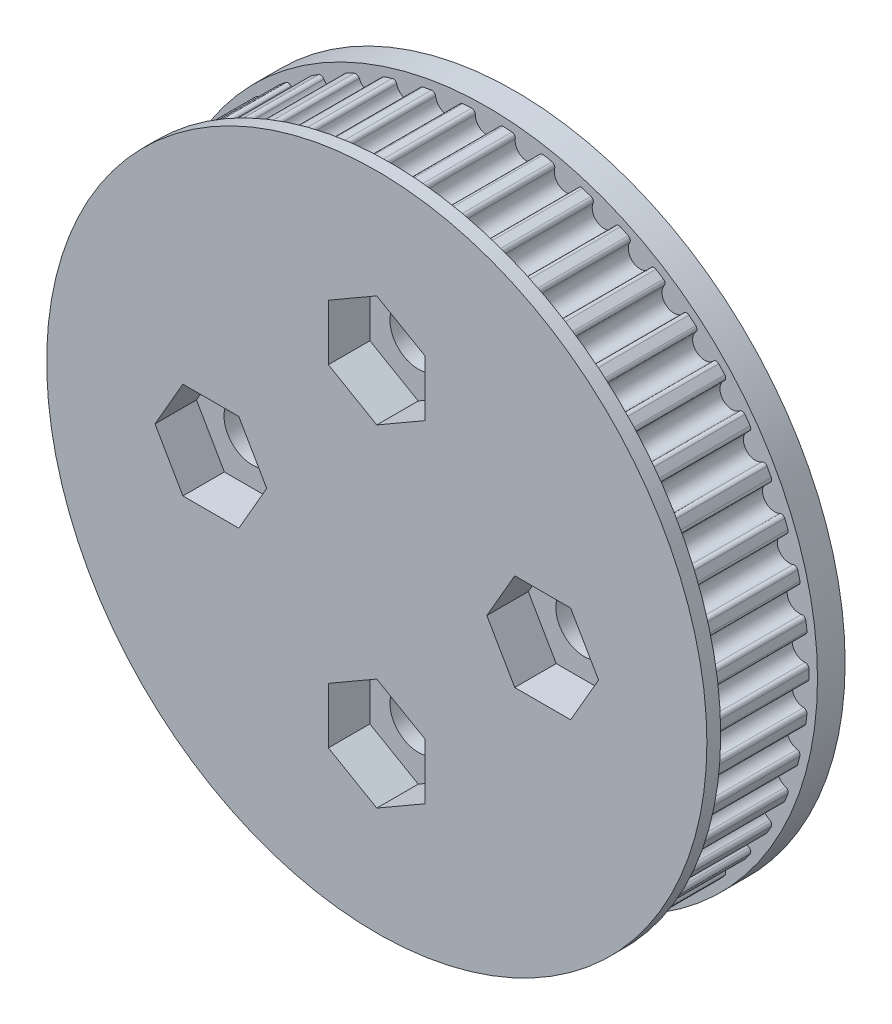
from build123d import *

# Parameters (mm, degrees)
BOSS_EXTRUDE2_DEPTH      = 3.5
FILLET2_R                = 0.26
CIRPATTERN6_COUNT        = 50
FILLET2_OF_CIRPATTERN6_R = 0.26
SKETCH2_R                = 23.875
BOSS_EXTRUDE3_DEPTH      = 1
SKETCH2_6_R              = 2.05
CUT_EXTRUDE4_DEPTH       = 2
SKETCH2_7_R              = 2.05
CUT_EXTRUDE5_DEPTH       = 7
BOSS_EXTRUDE4_START      = -7
SKETCH2_8_R              = 23.875
SKETCH2_8_R_2            = 2.05
BOSS_EXTRUDE4_DEPTH      = 2
SKETCH5_R                = 16.25
CUT_EXTRUDE6_DEPTH       = 3


with BuildPart() as part:
    # Sketch1 → Boss-Extrude2 (new, symmetric)
    with BuildSketch(Plane(origin=(0, 0, 0), x_dir=(0, 1, 0), z_dir=(0, 0, 1))):
        with BuildLine():
            Line((1.386932157, 22.044655365), (0, 0))
            Line((0, 0), (2.91503061, 23.074843283))
            ThreePointArc((2.91503061, 23.074843283), (2.597607065, 23.11272882), (2.279692792, 23.146248006))
            ThreePointArc((2.279692792, 23.146248006), (2.117464236, 22.36516737), (1.386932157, 22.044655365))
        make_face()
        with BuildLine():
            Line((0, 23.258241464), (0, 0))
            Line((0, 0), (1.386932157, 22.044655365))
            ThreePointArc((1.386932157, 22.044655365), (0.702331348, 22.454199985), (0.639277374, 23.249454196))
            ThreePointArc((0.639277374, 23.249454196), (0.319668882, 23.256044543), (0, 23.258241464))
        make_face()
    boss_extrude2 = extrude(amount=BOSS_EXTRUDE2_DEPTH, both=True)

    # Fillet2
    fillet2_edges = [part.edges().sort_by_distance(p)[0] for p in [
        (-23.146248006, 2.279692792, 0),
        (-23.249454196, 0.639277374, 0),
    ]]
    fillet(fillet2_edges, radius=FILLET2_R)

    # CirPattern6: Boss-Extrude2 ×50 about axis
    cirpattern6_axis = Axis((0, 0, 0), (0, 0, 1))
    for i in range(1, CIRPATTERN6_COUNT):
        add(boss_extrude2.rotate(cirpattern6_axis, i * 360 / CIRPATTERN6_COUNT))

    # Fillet2 of CirPattern6
    fillet2_of_cirpattern6_edges = [part.edges().sort_by_distance(p)[0] for p in [
        (-23.249454196, -0.639277374, 0),
        (-23.146248006, -2.279692792, 0),
        (-22.986002605, -3.548165754, 0),
        (-22.678011658, -5.162710841, 0),
        (-22.360048022, -6.40109744, 0),
        (-21.852129519, -7.964309856, 0),
        (-21.381462124, -9.153079997, 0),
        (-20.681626243, -10.640306947, 0),
        (-20.065677796, -11.760713013, 0),
        (-19.184961367, -13.148500041, 0),
        (-18.433445742, -14.18287256, 0),
        (-17.38573819, -15.449333435, 0),
        (-16.510507238, -16.381359734, 0),
        (-15.312331536, -17.506521611, 0),
        (-14.327188171, -18.32150308, 0),
        (-12.997440266, -19.287621484, 0),
        (-11.917920788, -19.972705377, 0),
        (-10.477571599, -20.764544044, 0),
        (-9.320700675, -21.308926179, 0),
        (-7.792465369, -21.913997341, 0),
        (-6.576487544, -22.309092486, 0),
        (-4.984467305, -22.717853809, 0),
        (-3.728559277, -22.957431078, 0),
        (-2.097861214, -23.163436151, 0),
        (-0.821829402, -23.243717268, 0),
        (0.821829402, -23.243717268, 0),
        (2.097861214, -23.163436151, 0),
        (3.728559277, -22.957431078, 0),
        (4.984467305, -22.717853809, 0),
        (6.576487544, -22.309092486, 0),
        (7.792465369, -21.913997341, 0),
        (9.320700675, -21.308926179, 0),
        (10.477571599, -20.764544044, 0),
        (11.917920788, -19.972705377, 0),
        (12.997440266, -19.287621484, 0),
        (14.327188171, -18.32150308, 0),
        (15.312331536, -17.506521611, 0),
        (16.510507238, -16.381359734, 0),
        (17.38573819, -15.449333435, 0),
        (18.433445742, -14.18287256, 0),
        (19.184961367, -13.148500041, 0),
        (20.065677796, -11.760713013, 0),
        (20.681626243, -10.640306947, 0),
        (21.381462124, -9.153079997, 0),
        (21.852129519, -7.964309856, 0),
        (22.360048022, -6.40109744, 0),
        (22.678011658, -5.162710841, 0),
        (22.986002605, -3.548165754, 0),
        (23.146248006, -2.279692792, 0),
        (23.249454196, -0.639277374, 0),
        (23.249454196, 0.639277374, 0),
        (23.146248006, 2.279692792, 0),
        (22.986002605, 3.548165754, 0),
        (22.678011658, 5.162710841, 0),
        (22.360048022, 6.40109744, 0),
        (21.852129519, 7.964309856, 0),
        (21.381462124, 9.153079997, 0),
        (20.681626243, 10.640306947, 0),
        (20.065677796, 11.760713013, 0),
        (19.184961367, 13.148500041, 0),
        (18.433445742, 14.18287256, 0),
        (17.38573819, 15.449333435, 0),
        (16.510507238, 16.381359734, 0),
        (15.312331536, 17.506521611, 0),
        (14.327188171, 18.32150308, 0),
        (12.997440266, 19.287621484, 0),
        (11.917920788, 19.972705377, 0),
        (10.477571599, 20.764544044, 0),
        (9.320700675, 21.308926179, 0),
        (7.792465369, 21.913997341, 0),
        (6.576487544, 22.309092486, 0),
        (4.984467305, 22.717853809, 0),
        (3.728559277, 22.957431078, 0),
        (2.097861214, 23.163436151, 0),
        (0.821829402, 23.243717268, 0),
        (-0.821829402, 23.243717268, 0),
        (-2.097861214, 23.163436151, 0),
        (-3.728559277, 22.957431078, 0),
        (-4.984467305, 22.717853809, 0),
        (-6.576487544, 22.309092486, 0),
        (-7.792465369, 21.913997341, 0),
        (-9.320700675, 21.308926179, 0),
        (-10.477571599, 20.764544044, 0),
        (-11.917920788, 19.972705377, 0),
        (-12.997440266, 19.287621484, 0),
        (-14.327188171, 18.32150308, 0),
        (-15.312331536, 17.506521611, 0),
        (-16.510507238, 16.381359734, 0),
        (-17.38573819, 15.449333435, 0),
        (-18.433445742, 14.18287256, 0),
        (-19.184961367, 13.148500041, 0),
        (-20.065677796, 11.760713013, 0),
        (-20.681626243, 10.640306947, 0),
        (-21.381462124, 9.153079997, 0),
        (-21.852129519, 7.964309856, 0),
        (-22.360048022, 6.40109744, 0),
        (-22.678011658, 5.162710841, 0),
        (-22.986002605, 3.548165754, 0),
    ]]
    fillet(fillet2_of_cirpattern6_edges, radius=FILLET2_OF_CIRPATTERN6_R)

    # Sketch2 → Boss-Extrude3 (add)
    with BuildSketch(Plane.XY.offset(3.5)):
        Circle(SKETCH2_R)
        Polygon((3.5, 14.020725942), (0, 16.041451884), (-3.5, 14.020725942), (-3.5, 9.979274058), (0, 7.958548116), (3.5, 9.979274058), align=None, mode=Mode.SUBTRACT)
        Polygon((14.020725942, -3.5), (16.041451884, 0), (14.020725942, 3.5), (9.979274058, 3.5), (7.958548116, 0), (9.979274058, -3.5), align=None, mode=Mode.SUBTRACT)
        Polygon((-3.5, -14.020725942), (0, -16.041451884), (3.5, -14.020725942), (3.5, -9.979274058), (0, -7.958548116), (-3.5, -9.979274058), align=None, mode=Mode.SUBTRACT)
        Polygon((-14.020725942, 3.5), (-16.041451884, 0), (-14.020725942, -3.5), (-9.979274058, -3.5), (-7.958548116, 0), (-9.979274058, 3.5), align=None, mode=Mode.SUBTRACT)
    extrude(amount=BOSS_EXTRUDE3_DEPTH)

    # Sketch2<6> → Cut-Extrude4 (cut)
    # profile 1 of 4: a face of its own
    with BuildSketch(Plane.XY.offset(3.5)):
        Polygon((-3.5, -9.979274058), (-3.5, -14.020725942), (0, -16.041451884), (3.5, -14.020725942), (3.5, -9.979274058), (0, -7.958548116), align=None)
        with Locations((0, -12)):
            Circle(SKETCH2_6_R, mode=Mode.SUBTRACT)
    # profile 2 of 4: a face of its own
    with BuildSketch(Plane.XY.offset(3.5)):
        Polygon((9.979274058, -3.5), (14.020725942, -3.5), (16.041451884, 0), (14.020725942, 3.5), (9.979274058, 3.5), (7.958548116, 0), align=None)
        with Locations((12, 0)):
            Circle(SKETCH2_6_R, mode=Mode.SUBTRACT)
    # profile 3 of 4: a face of its own
    with BuildSketch(Plane.XY.offset(3.5)):
        Polygon((-9.979274058, 3.5), (-14.020725942, 3.5), (-16.041451884, 0), (-14.020725942, -3.5), (-9.979274058, -3.5), (-7.958548116, 0), align=None)
        with Locations((-12, 0)):
            Circle(SKETCH2_6_R, mode=Mode.SUBTRACT)
    # profile 4 of 4: a face of its own
    with BuildSketch(Plane.XY.offset(3.5)):
        Polygon((3.5, 9.979274058), (3.5, 14.020725942), (0, 16.041451884), (-3.5, 14.020725942), (-3.5, 9.979274058), (0, 7.958548116), align=None)
        with Locations((0, 12)):
            Circle(SKETCH2_6_R, mode=Mode.SUBTRACT)
    extrude(amount=-CUT_EXTRUDE4_DEPTH, mode=Mode.SUBTRACT)

    # Sketch2<7> → Cut-Extrude5 (cut)
    with BuildSketch(Plane.XY.offset(3.5)):
        with Locations((12, 0)):
            Circle(SKETCH2_7_R)
        with Locations((0, -12)):
            Circle(SKETCH2_7_R)
        with Locations((-12, 0)):
            Circle(SKETCH2_7_R)
        with Locations((0, 12)):
            Circle(SKETCH2_7_R)
    extrude(amount=-CUT_EXTRUDE5_DEPTH, mode=Mode.SUBTRACT)

    # Sketch2<8> → Boss-Extrude4 (add)
    # profile 1 of 5: a face of its own
    with BuildSketch(Plane.XY.offset(3.5).offset(BOSS_EXTRUDE4_START)):
        Circle(SKETCH2_8_R)
        Polygon((3.5, 14.020725942), (0, 16.041451884), (-3.5, 14.020725942), (-3.5, 9.979274058), (0, 7.958548116), (3.5, 9.979274058), align=None, mode=Mode.SUBTRACT)
        Polygon((14.020725942, -3.5), (16.041451884, 0), (14.020725942, 3.5), (9.979274058, 3.5), (7.958548116, 0), (9.979274058, -3.5), align=None, mode=Mode.SUBTRACT)
        Polygon((-3.5, -14.020725942), (0, -16.041451884), (3.5, -14.020725942), (3.5, -9.979274058), (0, -7.958548116), (-3.5, -9.979274058), align=None, mode=Mode.SUBTRACT)
        Polygon((-14.020725942, 3.5), (-16.041451884, 0), (-14.020725942, -3.5), (-9.979274058, -3.5), (-7.958548116, 0), (-9.979274058, 3.5), align=None, mode=Mode.SUBTRACT)
    # profile 2 of 5: a face of its own
    with BuildSketch(Plane.XY.offset(3.5).offset(BOSS_EXTRUDE4_START)):
        Polygon((3.5, 9.979274058), (3.5, 14.020725942), (0, 16.041451884), (-3.5, 14.020725942), (-3.5, 9.979274058), (0, 7.958548116), align=None)
        with Locations((0, 12)):
            Circle(SKETCH2_8_R_2, mode=Mode.SUBTRACT)
    # profile 3 of 5: a face of its own
    with BuildSketch(Plane.XY.offset(3.5).offset(BOSS_EXTRUDE4_START)):
        Polygon((9.979274058, -3.5), (14.020725942, -3.5), (16.041451884, 0), (14.020725942, 3.5), (9.979274058, 3.5), (7.958548116, 0), align=None)
        with Locations((12, 0)):
            Circle(SKETCH2_8_R_2, mode=Mode.SUBTRACT)
    # profile 4 of 5: a face of its own
    with BuildSketch(Plane.XY.offset(3.5).offset(BOSS_EXTRUDE4_START)):
        Polygon((-3.5, -9.979274058), (-3.5, -14.020725942), (0, -16.041451884), (3.5, -14.020725942), (3.5, -9.979274058), (0, -7.958548116), align=None)
        with Locations((0, -12)):
            Circle(SKETCH2_8_R_2, mode=Mode.SUBTRACT)
    # profile 5 of 5: a face of its own
    with BuildSketch(Plane.XY.offset(3.5).offset(BOSS_EXTRUDE4_START)):
        Polygon((-9.979274058, 3.5), (-14.020725942, 3.5), (-16.041451884, 0), (-14.020725942, -3.5), (-9.979274058, -3.5), (-7.958548116, 0), align=None)
        with Locations((-12, 0)):
            Circle(SKETCH2_8_R_2, mode=Mode.SUBTRACT)
    extrude(amount=-BOSS_EXTRUDE4_DEPTH)

    # Sketch5 → Cut-Extrude6 (cut)
    with BuildSketch(Plane(origin=(0, 0, -5.5), x_dir=(1, 0, 0), z_dir=(0, 0, -1))):
        with Locations(Location((0, 0, 0), (0, 0, 180))):
            Circle(SKETCH5_R)
    extrude(amount=-CUT_EXTRUDE6_DEPTH, mode=Mode.SUBTRACT)


solid = part.part
